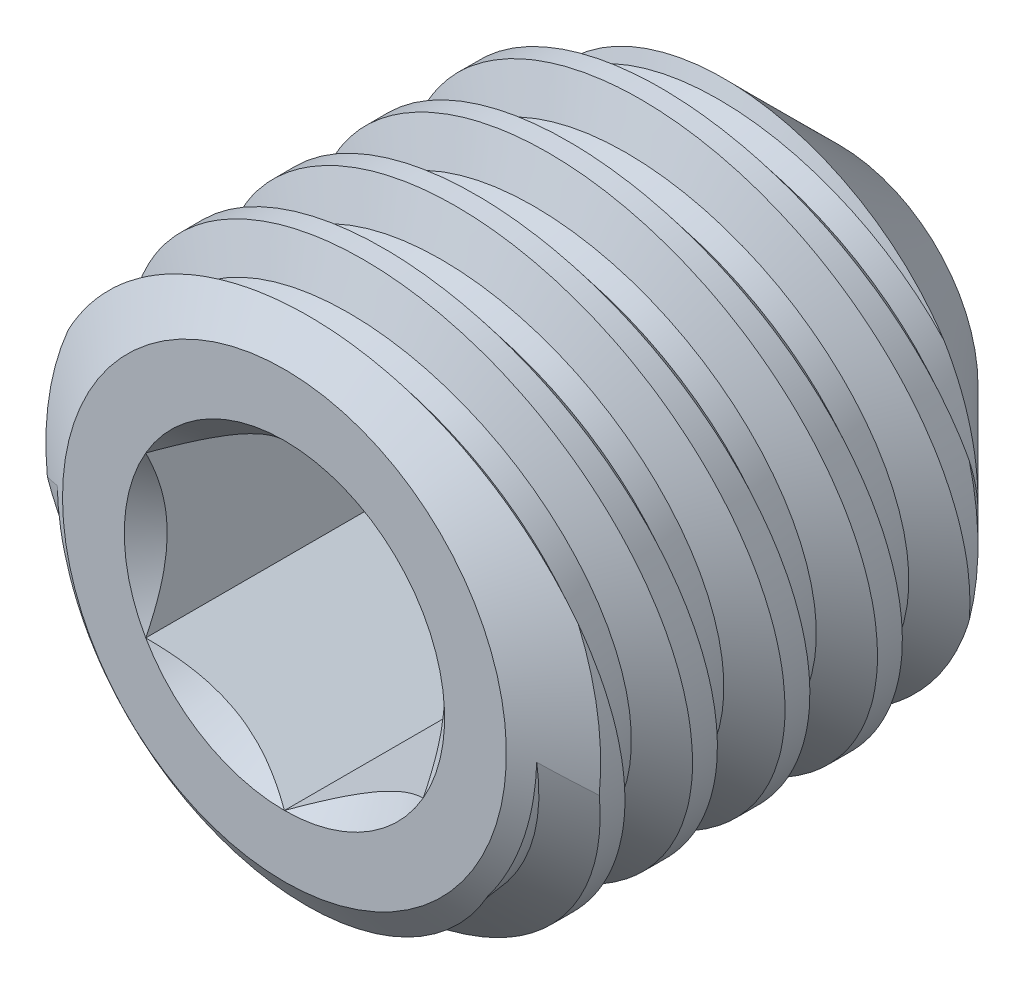
from build123d import *

# Parameters (mm, degrees)
LPATTERN1_COUNT      = 5
LPATTERN1_PITCH      = 0.5
LPATTERN1_COUNT_DIR2 = 2
LPATTERN1_PITCH_DIR2 = 0.5
CUT_EXTRUDE10_DEPTH  = 1.5


with BuildPart() as part:
    # Sketch22 → Revolve1 (revolve)
    with BuildSketch(Plane(origin=(0, 0, 0), x_dir=(0, 0, -1), z_dir=(1, 0, 0))):
        Polygon((-1.274677268, 0), (-1.274677268, 1.2), (-1.064615006, 1.5), (0.975322732, 1.5), (1.725322732, 0.75), (1.274677268, 0), align=None)
    revolve(axis=Axis((0, 0, -1.274677268), (0, 0, -1)))

    # Sketch6 → Cut-Revolve8 (revolve, cut)
    with BuildSketch(Plane(origin=(0, 0, 0), x_dir=(0, 0, -1), z_dir=(1, 0, 0))):
        Polygon((0.573757931, 1.289561466), (0.45045869, 1.269011592), (0.251842859, 1.510274937), (0.6833902, 1.582199494), align=None)
    cut_revolve8 = revolve(axis=Axis((0, 0.089188249, -1.260452226), (0, -0.16439898730536787, 0.986393923832142)), mode=Mode.SUBTRACT)

    # LPattern1: Cut-Revolve8 5 × 2
    with Locations(*[Vector(0, 0, 1) * (i * LPATTERN1_PITCH) + Vector(0, 0, -1) * (j * LPATTERN1_PITCH_DIR2) for i in range(LPATTERN1_COUNT) for j in range(LPATTERN1_COUNT_DIR2) if (i, j) != (0, 0)]):
        add(cut_revolve8, mode=Mode.SUBTRACT)

    # Sketch23 → Cut-Extrude10 (cut)
    with BuildSketch(Plane.XY.offset(1.274677268)):
        Polygon((0, 0.866025404), (-0.75, 0.433012702), (-0.75, -0.433012702), (0, -0.866025404), (0.75, -0.433012702), (0.75, 0.433012702), align=None)
    extrude(amount=-CUT_EXTRUDE10_DEPTH, mode=Mode.SUBTRACT)

    # Cut-Extrude11 cone 1 section (through the dimple's axis) → Cut-Extrude11 (revolve, cut)
    with BuildSketch(Plane(origin=(0, 0, 1.274677268), x_dir=(0, -1, 0), z_dir=(1, 0, 0))):
        Polygon((0, 0), (0.866025404, 0), (0, 0.866025404), align=None)
    revolve(axis=Axis((0, 0, 1.274677268), (0, 0, -1)), mode=Mode.SUBTRACT)

    # Cut-Extrude12 cone 1 section (through the dimple's axis) → Cut-Extrude12 (revolve, cut)
    with BuildSketch(Plane(origin=(0, 0, -0.225322732), x_dir=(0, -1, 0), z_dir=(1, 0, 0))):
        Polygon((0, 0), (0.75, 0), (0, 0.450645464), align=None)
    revolve(axis=Axis((0, 0, -0.225322732), (0, 0, -1)), mode=Mode.SUBTRACT)


solid = part.part
